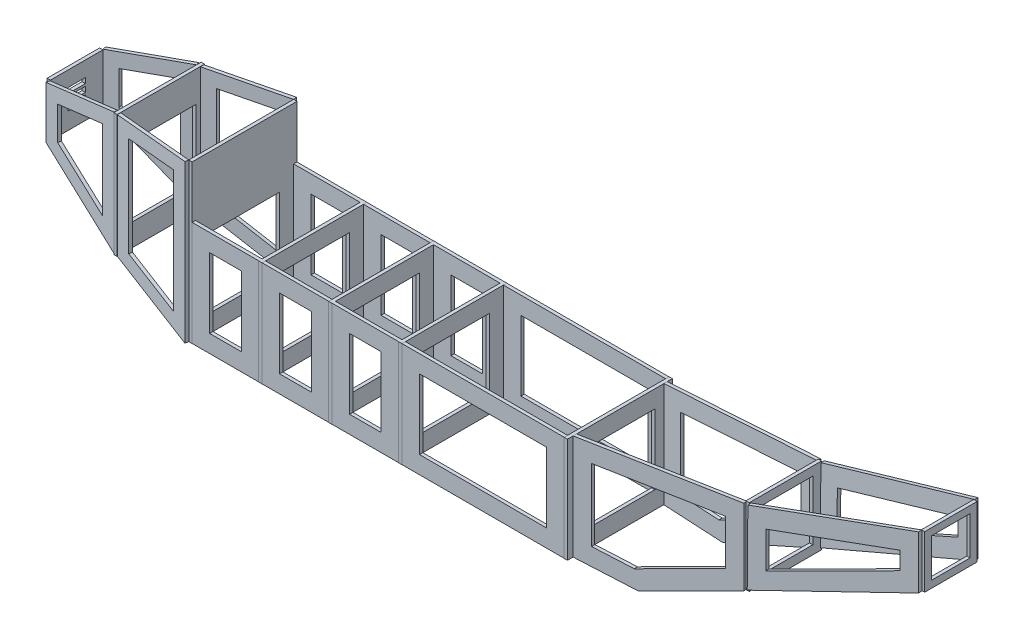
from build123d import *

# Parameters (mm, degrees)
SKETCH3_W            = 152.4
SKETCH3_H            = 228.6
SKETCH3_W_2          = 101.6
SKETCH3_H_2          = 101.6
BOSS_EXTRUDE1_DEPTH  = 4.826
SKETCH4_W            = 152.4
SKETCH4_H            = 152.4
SKETCH4_W_2          = 101.6
SKETCH4_H_2          = 101.6
BOSS_EXTRUDE2_DEPTH  = 4.826
SKETCH5_W            = 152.4
SKETCH5_H            = 152.4
SKETCH5_W_2          = 101.6
SKETCH5_H_2          = 101.6
BOSS_EXTRUDE3_DEPTH  = 4.826
SKETCH6_W            = 152.4
SKETCH6_H            = 152.4
SKETCH6_W_2          = 101.6
SKETCH6_H_2          = 101.6
BOSS_EXTRUDE4_DEPTH  = 4.826
SKETCH9_W            = 152.4
SKETCH9_H            = 152.4
SKETCH9_W_2          = 101.6
SKETCH9_H_2          = 101.6
BOSS_EXTRUDE5_DEPTH  = 4.826
SKETCH10_W           = 104.94518
SKETCH10_H           = 111.7937058
SKETCH10_W_2         = 79.54518
SKETCH10_H_2         = 86.3937058
BOSS_EXTRUDE6_DEPTH  = 4.826
SKETCH11_W           = 76.2
SKETCH11_H           = 76.2
SKETCH11_W_2         = 55.88
SKETCH11_H_2         = 55.88
BOSS_EXTRUDE7_DEPTH  = 4.826
SKETCH12_W           = 127
SKETCH12_H           = 178.5523734
SKETCH12_W_2         = 101.6
SKETCH12_H_2         = 101.6
BOSS_EXTRUDE8_DEPTH  = 4.826
SKETCH14_W           = 76.2
SKETCH14_H           = 76.200448132
BOSS_EXTRUDE9_DEPTH  = 4.826
SKETCH15_W           = 96.774
SKETCH15_H           = 152.4
SKETCH15_W_2         = 45.974
SKETCH15_H_2         = 101.6
BOSS_EXTRUDE10_DEPTH = 4.826
BOSS_EXTRUDE11_DEPTH = 4.826
BOSS_EXTRUDE13_DEPTH = 4.826
MIRROR10_START       = -80.112518851
MIRROR10_DEPTH       = 4.826
BOSS_EXTRUDE14_DEPTH = 4.826
SKETCH29_W           = 25.4
SKETCH29_H           = 7.62
CUT_EXTRUDE1_DEPTH   = 5.08


# Read off the part's stored shape, not the designer's step: Mirror10
with BuildPart() as part:
    # Sketch3 → Boss-Extrude1 (new body)
    with BuildSketch(Plane(origin=(0, 0, 0), x_dir=(0, 0, -1), z_dir=(1, 0, 0))):
        Rectangle(SKETCH3_W, SKETCH3_H)
        with Locations((0, -38.1)):
            Rectangle(SKETCH3_W_2, SKETCH3_H_2, mode=Mode.SUBTRACT)
    extrude(amount=BOSS_EXTRUDE1_DEPTH)



with BuildPart() as body_2:
    # Sketch4 → Boss-Extrude2 (new body)
    with BuildSketch(Plane(origin=(101.6, 0, 0), x_dir=(0, 0, -1), z_dir=(1, 0, 0))):
        with Locations((0, -38.1)):
            Rectangle(SKETCH4_W, SKETCH4_H)
        with Locations((0, -38.1)):
            Rectangle(SKETCH4_W_2, SKETCH4_H_2, mode=Mode.SUBTRACT)
    extrude(amount=BOSS_EXTRUDE2_DEPTH)


with BuildPart() as body_3:
    # Sketch5 → Boss-Extrude3 (new body)
    with BuildSketch(Plane(origin=(203.2, 0, 0), x_dir=(0, 0, -1), z_dir=(1, 0, 0))):
        with Locations((0, -38.147875219)):
            Rectangle(SKETCH5_W, SKETCH5_H)
        with Locations((0, -38.147875219)):
            Rectangle(SKETCH5_W_2, SKETCH5_H_2, mode=Mode.SUBTRACT)
    extrude(amount=BOSS_EXTRUDE3_DEPTH)


with BuildPart() as body_4:
    # Sketch6 → Boss-Extrude4 (new body)
    with BuildSketch(Plane(origin=(304.8, 0, 0), x_dir=(0, 0, -1), z_dir=(1, 0, 0))):
        with Locations((0, -38.147875219)):
            Rectangle(SKETCH6_W, SKETCH6_H)
        with Locations((0, -38.147875219)):
            Rectangle(SKETCH6_W_2, SKETCH6_H_2, mode=Mode.SUBTRACT)
    extrude(amount=BOSS_EXTRUDE4_DEPTH)


with BuildPart() as body_5:
    # Sketch9 → Boss-Extrude5 (new body)
    with BuildSketch(Plane(origin=(545.25164, 0, 0), x_dir=(0, 0, -1), z_dir=(1, 0, 0))):
        with Locations((0, -38.170785368)):
            Rectangle(SKETCH9_W, SKETCH9_H)
        with Locations((0, -38.170785368)):
            Rectangle(SKETCH9_W_2, SKETCH9_H_2, mode=Mode.SUBTRACT)
    extrude(amount=BOSS_EXTRUDE5_DEPTH)


with BuildPart() as body_6:
    # Sketch10 → Boss-Extrude6 (new body)
    with BuildSketch(Plane(origin=(785.70328, 0, 0), x_dir=(0, 0, -1), z_dir=(1, 0, 0))):
        with Locations((0, 10.670038934)):
            Rectangle(SKETCH10_W, SKETCH10_H)
        with Locations((0, 10.670038934)):
            Rectangle(SKETCH10_W_2, SKETCH10_H_2, mode=Mode.SUBTRACT)
    extrude(amount=BOSS_EXTRUDE6_DEPTH)

    # Sketch18 → Boss-Extrude11 (add)
    # profile 1 of 2: a face of its own
    with BuildSketch(Plane(origin=(4.874777656, 0, 92.295981855), x_dir=(0, -1, 0), z_dir=(0.05274327633420084, 0, 0.9986081047145242))):
        Polygon((114.085598097, 546.201147736), (114.085598097, 636.470091299), (44.822406836, 782.119110267), (-65.34759956, 782.119110267), (-38.482315652, 546.201147736), align=None)
        Polygon((-15.81059569, 571.601147736), (88.685598097, 571.601147736), (88.685598097, 630.73818354), (28.775541133, 756.719110267), (-36.891002483, 756.719110267), align=None, mode=Mode.SUBTRACT)
    # profile 2 of 2: a face of its own
    with BuildSketch(Plane(origin=(4.874777656, 0, 92.295981855), x_dir=(0, -1, 0), z_dir=(0.05274327633420084, 0, 0.9986081047145242))):
        Polygon((-65.675076797, 787.497213414), (-143.425847997, 1023.429412025), (-66.467206835, 1023.429412025), (41.861460715, 786.630378107), align=None)
        Polygon((5.432984264, 812.286850028), (-47.249988421, 812.739755143), (-108.311656997, 998.029412025), (-82.541791786, 998.029412025), align=None, mode=Mode.SUBTRACT)
    boss_extrude11 = extrude(amount=BOSS_EXTRUDE11_DEPTH)

    # Mirror11: Boss-Extrude11 across plane
    add(boss_extrude11.mirror(Plane.XY))


with BuildPart() as body_7:
    # Sketch11 → Boss-Extrude7 (new body)
    with BuildSketch(Plane(origin=(1026.16, 0, 0), x_dir=(0, 0, -1), z_dir=(1, 0, 0))):
        with Locations((0, 105.054261628)):
            Rectangle(SKETCH11_W, SKETCH11_H)
        with Locations((0, 105.054261628)):
            Rectangle(SKETCH11_W_2, SKETCH11_H_2, mode=Mode.SUBTRACT)
    extrude(amount=BOSS_EXTRUDE7_DEPTH)


with BuildPart() as body_8:
    # Sketch12 → Boss-Extrude8 (new body)
    with BuildSketch(Plane(origin=(-121.92, 0, 0), x_dir=(0, 0, -1), z_dir=(1, 0, 0))):
        with Locations((0.302227033, 17.0865673)):
            Rectangle(SKETCH12_W, SKETCH12_H)
        with Locations((0.302227033, 11.142262391)):
            Rectangle(SKETCH12_W_2, SKETCH12_H_2, mode=Mode.SUBTRACT)
    extrude(amount=BOSS_EXTRUDE8_DEPTH)

    # Sketch20 → Boss-Extrude13 (add)
    # profile 1 of 2: a face of its own
    with BuildSketch(Plane(origin=(-11.622486027, 0, 74.38398846), x_dir=(0, -1, 0), z_dir=(-0.15437672248146, 0, 0.988012058406112))):
        Polygon((-105.960933781, -106.542284404), (-114.3, 11.763506253), (114.3, 11.763506253), (72.074304791, -106.542284404), align=None)
        Polygon((-87.022820385, -86.222284404), (-92.497279139, -8.556493747), (85.471873081, -8.556493747), (57.751404064, -86.222284404), align=None, mode=Mode.SUBTRACT)
    # profile 2 of 2: a face of its own
    with BuildSketch(Plane(origin=(-11.622486027, 0, 74.38398846), x_dir=(0, -1, 0), z_dir=(-0.15437672248146, 0, 0.988012058406112))):
        Polygon((72.074304791, -111.661441646), (0, -230.409207522), (-75.634537554, -230.409207522), (-105.960933781, -112.107039508), align=None)
        Polygon((-79.791708899, -132.361605161), (35.916066802, -132.072004417), (-11.43670345, -210.089207522), (-59.866477548, -210.089207522), align=None, mode=Mode.SUBTRACT)
    extrude(amount=BOSS_EXTRUDE13_DEPTH)


with BuildPart() as body_9:
    # Sketch14 → Boss-Extrude9 (new body)
    with BuildSketch(Plane(origin=(-243.84, 0, 0), x_dir=(0, 0, -1), z_dir=(1, 0, 0))):
        with Locations((0, 38.099775934)):
            Rectangle(SKETCH14_W, SKETCH14_H)
    extrude(amount=BOSS_EXTRUDE9_DEPTH)

    # Sketch29 → Cut-Extrude1 (cut)
    with BuildSketch(Plane.ZY.offset(243.84)):
        with Locations((0, 39.131772112)):
            Rectangle(SKETCH29_W, SKETCH29_H)
        with Locations((0, 50.280166319)):
            Rectangle(SKETCH29_W, SKETCH29_H)
        with Locations((0, 28.315032896)):
            Rectangle(SKETCH29_W, SKETCH29_H)
    extrude(amount=-CUT_EXTRUDE1_DEPTH, mode=Mode.SUBTRACT)


with BuildPart() as part_1:
    add(part.part)

    add(body_2.part)  # Boss-Extrude10 merges body 2

    add(body_3.part)  # Boss-Extrude10 merges body 3

    add(body_4.part)  # Boss-Extrude10 merges body 4
    # Sketch15 → Boss-Extrude10 (add)
    # profile 1 of 4: a face of its own
    with BuildSketch(Plane.XY.offset(71.2216)):
        with Locations((53.213, -38.1)):
            Rectangle(SKETCH15_W, SKETCH15_H)
        with Locations((53.213, -38.1)):
            Rectangle(SKETCH15_W_2, SKETCH15_H_2, mode=Mode.SUBTRACT)
    # profile 2 of 4: a face of its own
    with BuildSketch(Plane.XY.offset(71.2216)):
        Polygon((203.2, 38.052124781), (106.426, 38.1), (106.426, -114.3), (203.2, -114.347875219), align=None)
        Polygon((131.826, -88.912562566), (131.826, 12.687431218), (177.8, 12.664687347), (177.8, -88.935306436), align=None, mode=Mode.SUBTRACT)
    # profile 3 of 4: a face of its own
    with BuildSketch(Plane.XY.offset(71.2216)):
        Polygon((304.8, 38.052124781), (208.026, 38.052124781), (208.026, -114.347875219), (304.8, -114.3), align=None)
        Polygon((233.426, -88.935306436), (233.426, 12.652124781), (279.4, 12.652124781), (279.4, -88.912562566), align=None, mode=Mode.SUBTRACT)
    # profile 4 of 4: a face of its own
    with BuildSketch(Plane.XY.offset(71.2216)):
        Polygon((545.25164, 38.029214632), (309.626, 38.052124781), (309.626, -114.3), (545.25164, -114.370785368), align=None)
        Polygon((335.026, 12.64965499), (519.85164, 12.631684182), (519.85164, -88.963153693), (335.026, -88.907629383), align=None, mode=Mode.SUBTRACT)
    boss_extrude10 = extrude(amount=BOSS_EXTRUDE10_DEPTH)

    # Mirror1: Boss-Extrude10 across plane
    add(boss_extrude10.mirror(Plane.XY))


with BuildPart() as boss_extrude13_piece_1:
    # of the separate pieces the step leaves, piece 1, a body of its own (boss_extrude13_pieces)
    add(body_8.part.solids().sort_by_distance((-121.92, -72.1896194, 63.197772967))[0])

    # Mirror10 outline → Mirror10 (add)
    with BuildSketch(Plane(origin=(0, 0, 0), x_dir=(0.9880120584061118, 0, -0.15437672248146), z_dir=(0.15437672248146, 0, 0.988012058406112)).offset(MIRROR10_START)):
        Polygon((-106.542284404, 105.960933781), (-106.542284404, -72.074304791), (11.763506253, -114.3), (11.763506253, 114.3), align=None)
        Polygon((-8.556493747, -85.471873081), (-86.222284404, -57.751404064), (-86.222284404, 87.022820385), (-8.556493747, 92.497279139), align=None, mode=Mode.SUBTRACT)
    extrude(amount=MIRROR10_DEPTH)


with BuildPart() as boss_extrude13_piece_2:
    # of the separate pieces the step leaves, piece 2, a body of its own (boss_extrude13_pieces)
    add(body_8.part.solids().sort_by_distance((-121.945336832, -72.074304791, 57.146061071))[0])


with BuildPart() as body_8_2:
    # Sketch23 → Boss-Extrude14 (new body)
    with BuildSketch(Plane(origin=(-11.622486027, 0, -74.38398846), x_dir=(0, 1, 0), z_dir=(-0.15437672248146025, 0, -0.9880120584061118))):
        Polygon((106.251517961, -111.964686306), (76.475808528, -230.700928796), (0, -230.700928796), (-72.110023891, -111.964686306), align=None)
        Polygon((80.206647462, -132.284686306), (60.62230678, -210.380928796), (11.43318725, -210.380928796), (-35.995649924, -132.284686306), align=None, mode=Mode.SUBTRACT)
    extrude(amount=BOSS_EXTRUDE14_DEPTH)


solid = Compound([body_5.part, body_6.part, body_7.part, body_9.part, part_1.part, boss_extrude13_piece_1.part, boss_extrude13_piece_2.part, body_8_2.part])
